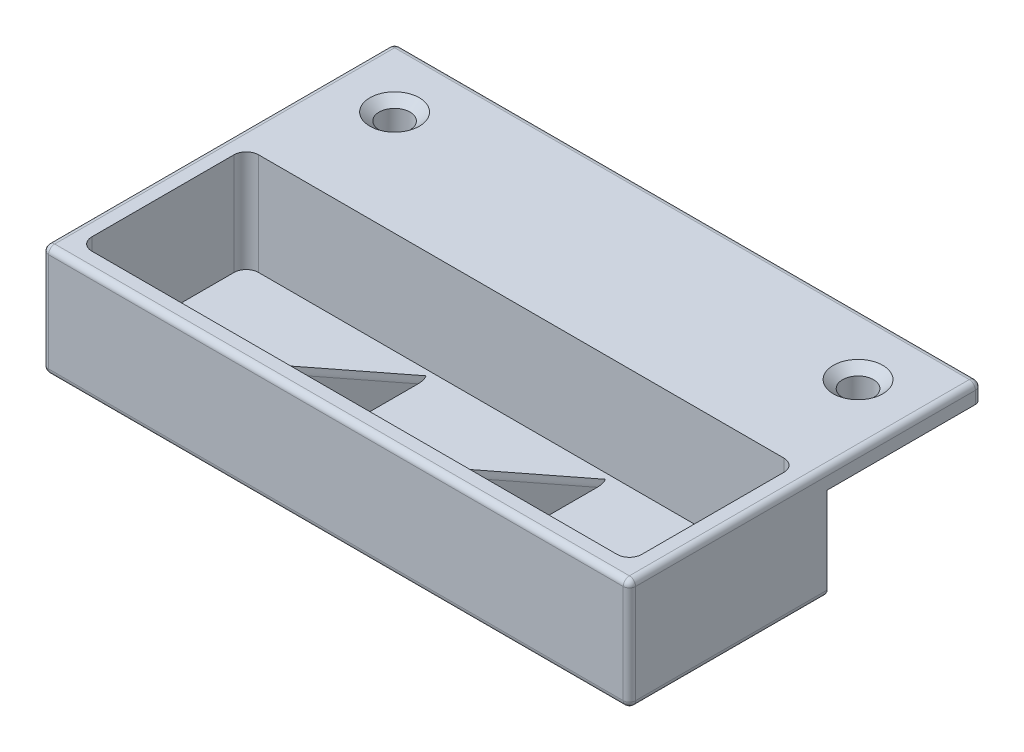
from build123d import *

# Parameters (mm, degrees)
SKETCH2_W                                         = 95
SKETCH2_H                                         = 57
BOSS_EXTRUDE1_DEPTH                               = 18
SKETCH3_W                                         = 25
SKETCH3_H                                         = 15
CUT_EXTRUDE1_DEPTH                                = 101.803025748
CUT_EXTRUDE2_DEPTH                                = 16.5
SKETCH14_R                                        = 6
BOSS_EXTRUDE3_DEPTH                               = 2
CSK_FOR_4_FLAT_HEAD_MACHINE_SCREW_100_D           = 5
CSK_FOR_4_FLAT_HEAD_MACHINE_SCREW_100_CSINK_D     = 8
CSK_FOR_4_FLAT_HEAD_MACHINE_SCREW_100_CSINK_ANGLE = 100
RIB3_START                                        = -0.5
RIB3_DEPTH                                        = 1
RIB11_START                                       = -0.5
RIB11_DEPTH                                       = 1
FILLET1_R                                         = 1
FILLET2_R                                         = 1
FILLET3_R                                         = 1


# Read off the part's stored shape, not the designer's step: Rib3, Rib11
with BuildPart() as part:
    # Sketch2 → Boss-Extrude1 (new body)
    with BuildSketch(Plane(origin=(0, 0, 0), x_dir=(1, 0, 0), z_dir=(0, 1, 0))):
        Rectangle(SKETCH2_W, SKETCH2_H)
    extrude(amount=BOSS_EXTRUDE1_DEPTH)

    # Sketch3 → Cut-Extrude1 (cut, through all)
    with BuildSketch(Plane(origin=(47.5, 0, 0), x_dir=(0, 0, -1), z_dir=(1, 0, 0))):
        with Locations((16, 7.5)):
            Rectangle(SKETCH3_W, SKETCH3_H)
    extrude(amount=-CUT_EXTRUDE1_DEPTH, mode=Mode.SUBTRACT)

    # Sketch4 → Cut-Extrude2 (cut)
    with BuildSketch(Plane(origin=(0, 18, 0), x_dir=(1, 0, 0), z_dir=(0, 1, 0))):
        with BuildLine():
            Line((-42.5, 1.5), (42.5, 1.5))
            ThreePointArc((42.5, 1.5), (43.914213562, 0.914213562), (44.5, -0.5))
            Line((44.5, -0.5), (44.5, -23.5))
            ThreePointArc((44.5, -23.5), (43.914213562, -24.914213562), (42.5, -25.5))
            Line((42.5, -25.5), (-42.5, -25.5))
            ThreePointArc((-42.5, -25.5), (-43.914213562, -24.914213562), (-44.5, -23.5))
            Line((-44.5, -23.5), (-44.5, -0.5))
            ThreePointArc((-44.5, -0.5), (-43.914213562, 0.914213562), (-42.5, 1.5))
        make_face()
    extrude(amount=-CUT_EXTRUDE2_DEPTH, mode=Mode.SUBTRACT)

    # Sketch14 → Boss-Extrude3 (add)
    with BuildSketch(Plane(origin=(0, 15, 0), x_dir=(-1, 0, 0), z_dir=(0, -1, 0))):
        with Locations(Location((37.5, 18.5, 0), (0, 0, 270))):
            Circle(SKETCH14_R)
        with Locations(Location((-37.5, 18.5, 0), (0, 0, 270))):
            Circle(SKETCH14_R)
    extrude(amount=BOSS_EXTRUDE3_DEPTH)

    # CSK for #4 Flat Head Machine Screw (100)3 (through all)
    with Locations(Plane(origin=(37.5, 18, -18.5), x_dir=(0, 0, 1), z_dir=(0, 1, 0))):
        with Locations((0, 0), (0, -75)):
            CounterSinkHole(CSK_FOR_4_FLAT_HEAD_MACHINE_SCREW_100_D / 2, CSK_FOR_4_FLAT_HEAD_MACHINE_SCREW_100_CSINK_D / 2, counter_sink_angle=CSK_FOR_4_FLAT_HEAD_MACHINE_SCREW_100_CSINK_ANGLE)

    # Rib3 outline → Rib3 (add)
    with BuildSketch(Plane.ZY.offset(-14.5).offset(RIB3_START)):
        Polygon((25.5, 16.3125), (-0.833333333, 1.5), (25.5, 1.5), align=None)
    extrude(amount=RIB3_DEPTH)

    # Rib11 outline → Rib11 (add)
    with BuildSketch(Plane(origin=(-14.5, 0, 0), x_dir=(0, 0, -1), z_dir=(1, 0, 0)).offset(RIB11_START)):
        Polygon((0.833333333, 1.5), (-25.5, 16.3125), (-25.5, 1.5), align=None)
    extrude(amount=RIB11_DEPTH)

    # Fillet1
    # the kernel refuses this fillet: 1 mm, written as the material it takes off along each edge
    with BuildSketch(Plane(origin=(-15, 0.274346901, -3.012272176), x_dir=(0, -0.8715755371218976, 0.49026123963727325), z_dir=(0, 0.49026123963727325, 0.8715755371218976))) as fillet1_piece_1_section:
        with BuildLine():
            CenterArc((FILLET1_R, FILLET1_R), FILLET1_R, 180, 90)
            Line((0, FILLET1_R), (0, 0))
            Line((0, 0), (FILLET1_R, 0))
        make_face()
    fillet1_piece_1 = extrude(amount=35.213483756, mode=Mode.PRIVATE)
    fillet1_piece_1 = split(fillet1_piece_1, bisect_by=Plane(origin=(-14.771440182, 8.778475149, 25.5), z_dir=(0, 0, -1)), keep=Keep.TOP, mode=Mode.PRIVATE)
    fillet1_piece_1 = split(fillet1_piece_1, bisect_by=Plane(origin=(-14.771440182, 1.5, 12.560488623), z_dir=(0, 1, 0)), keep=Keep.TOP, mode=Mode.PRIVATE)
    add(fillet1_piece_1, mode=Mode.SUBTRACT)
    with BuildSketch(Plane(origin=(-14, 0.274346901, -3.012272176), x_dir=(-1, 0, 0), z_dir=(0, 0.49026123963727325, 0.8715755371218976))) as fillet1_piece_2_section:
        with BuildLine():
            CenterArc((FILLET1_R, FILLET1_R), FILLET1_R, 180, 90)
            Line((0, FILLET1_R), (0, 0))
            Line((0, 0), (FILLET1_R, 0))
        make_face()
    fillet1_piece_2 = extrude(amount=35.213483756, mode=Mode.PRIVATE)
    fillet1_piece_2 = split(fillet1_piece_2, bisect_by=Plane(origin=(-14.228559818, 8.778475149, 25.5), z_dir=(0, 0, -1)), keep=Keep.TOP, mode=Mode.PRIVATE)
    fillet1_piece_2 = split(fillet1_piece_2, bisect_by=Plane(origin=(-14.228559818, 1.5, 12.560488623), z_dir=(0, 1, 0)), keep=Keep.TOP, mode=Mode.PRIVATE)
    add(fillet1_piece_2, mode=Mode.SUBTRACT)
    with BuildSketch(Plane(origin=(14, 17.538153099, 27.678938843), x_dir=(0, -0.8715755371218977, 0.4902612396372733), z_dir=(0, -0.49026123963727325, -0.8715755371218976))) as fillet1_piece_3_section:
        with BuildLine():
            CenterArc((FILLET1_R, -FILLET1_R), FILLET1_R, 90, 90)
            Line((0, -FILLET1_R), (0, 0))
            Line((0, 0), (FILLET1_R, 0))
        make_face()
    fillet1_piece_3 = extrude(amount=35.213483756, mode=Mode.PRIVATE)
    fillet1_piece_3 = split(fillet1_piece_3, bisect_by=Plane(origin=(14.228559818, 8.778475149, 25.5), z_dir=(0, 0, -1)), keep=Keep.TOP, mode=Mode.PRIVATE)
    fillet1_piece_3 = split(fillet1_piece_3, bisect_by=Plane(origin=(14.228559818, 1.5, 12.560488623), z_dir=(0, 1, 0)), keep=Keep.TOP, mode=Mode.PRIVATE)
    add(fillet1_piece_3, mode=Mode.SUBTRACT)
    with BuildSketch(Plane(origin=(15, 17.538153099, 27.678938843), x_dir=(-1, 0, 0), z_dir=(0, -0.49026123963727325, -0.8715755371218976))) as fillet1_piece_4_section:
        with BuildLine():
            CenterArc((FILLET1_R, -FILLET1_R), FILLET1_R, 90, 90)
            Line((0, -FILLET1_R), (0, 0))
            Line((0, 0), (FILLET1_R, 0))
        make_face()
    fillet1_piece_4 = extrude(amount=35.213483756, mode=Mode.PRIVATE)
    fillet1_piece_4 = split(fillet1_piece_4, bisect_by=Plane(origin=(14.771440182, 8.778475149, 25.5), z_dir=(0, 0, -1)), keep=Keep.TOP, mode=Mode.PRIVATE)
    fillet1_piece_4 = split(fillet1_piece_4, bisect_by=Plane(origin=(14.771440182, 1.5, 12.560488623), z_dir=(0, 1, 0)), keep=Keep.TOP, mode=Mode.PRIVATE)
    add(fillet1_piece_4, mode=Mode.SUBTRACT)

    # Fillet2
    fillet2_edges = [part.edges().sort_by_distance(p)[0] for p in [
        (-47.5, 18, 0),
        (0, 18, 28.5),
        (47.5, 18, 0),
        (0, 0, 28.5),
        (47.5, 9, 28.5),
        (-47.5, 9, 28.5),
        (-47.5, 16.5, -28.5),
        (47.5, 16.5, -28.5),
        (0, 18, -28.5),
    ]]
    fillet(fillet2_edges, radius=FILLET2_R)

    # Fillet3
    # the kernel refuses this fillet: 1 mm, written as the material it takes off along each edge
    with BuildSketch(Plane(origin=(-46.5, 1, 27.5), x_dir=(0, -1, 0), z_dir=(-1, 0, 0))) as fillet3_piece_1_section:
        Polygon((0, 0), (FILLET3_R, 0), (FILLET3_R, FILLET3_R), (0, FILLET3_R), align=None)
    fillet3_piece_1 = extrude(amount=FILLET3_R, mode=Mode.PRIVATE)
    fillet3_piece_1 = fillet3_piece_1 - Plane(origin=(-46.5, 1, 27.5), x_dir=(0, 0.7071067811865475, -0.7071067811865475), z_dir=(-1, 0, 0)) * Sphere(FILLET3_R, mode=Mode.PRIVATE)
    add(fillet3_piece_1, mode=Mode.SUBTRACT)
    with BuildSketch(Plane(origin=(46.5, 1, 27.5), x_dir=(0, -1, 0), z_dir=(1, 0, 0))) as fillet3_piece_2_section:
        Polygon((0, 0), (FILLET3_R, 0), (FILLET3_R, -FILLET3_R), (0, -FILLET3_R), align=None)
    fillet3_piece_2 = extrude(amount=FILLET3_R, mode=Mode.PRIVATE)
    fillet3_piece_2 = fillet3_piece_2 - Plane(origin=(46.5, 1, 27.5), x_dir=(0, 0.7071067811865475, -0.7071067811865475), z_dir=(1, 0, 0)) * Sphere(FILLET3_R, mode=Mode.PRIVATE)
    add(fillet3_piece_2, mode=Mode.SUBTRACT)
    with BuildSketch(Plane(origin=(47.5, 0, -6), x_dir=(0, 1, 0), z_dir=(0, 0, 1)), Plane(origin=(-47.5, 0, 27.5), x_dir=(0, 1, 0), z_dir=(0, 0, -1))) as fillet3_piece_3:
        with BuildLine():
            CenterArc((FILLET3_R, FILLET3_R), FILLET3_R, 180, 90)
            Line((0, FILLET3_R), (0, 0))
            Line((0, 0), (FILLET3_R, 0))
        make_face()
    extrude(amount=33.5, mode=Mode.SUBTRACT)
    with BuildSketch(Plane(origin=(50, 0, -3.5), x_dir=(0, 1, 0), z_dir=(-1, 0, 0))) as fillet3_piece_4:
        with BuildLine():
            CenterArc((FILLET3_R, -FILLET3_R), FILLET3_R, 90, 90)
            Line((0, -FILLET3_R), (0, 0))
            Line((0, 0), (FILLET3_R, 0))
        make_face()
    extrude(amount=100, mode=Mode.SUBTRACT)


solid = part.part
